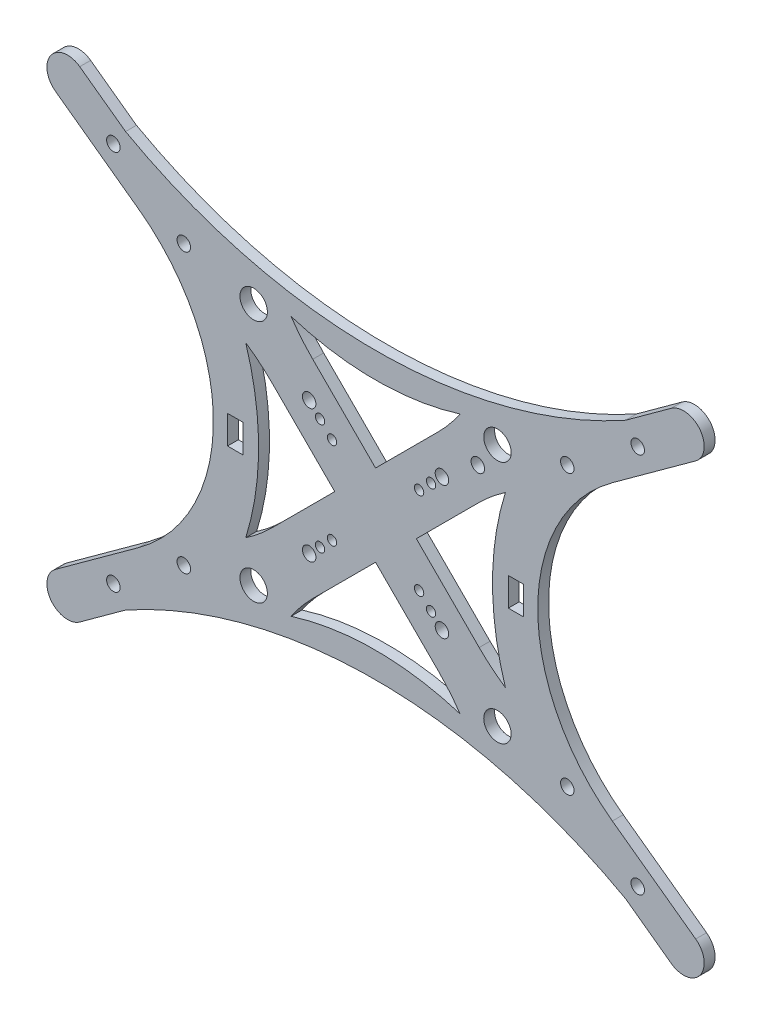
from build123d import *

# Parameters (mm, degrees)
SKETCH_7_R          = 1.075
SKETCH_7_R_2        = 1.55
SKETCH_7_R_3        = 3.15
SKETCH_7_R_4        = 3.150000003
EXTRUDE_2_5_DEPTH   = 2.5
CUT_EXTRUDE_2_DEPTH = 95.113928094
SKETCH_8_W          = 3.5
SKETCH_8_H          = 6.5
CUT_EXTRUDE_3_DEPTH = 95.113928094
PCB_2_R             = 1.55
PCB_DEPTH           = 95.113928094


with BuildPart() as part:
    # 草图7 → 主结构-厚度还是得2.5, 不然铝柱不好选 (new body)
    with BuildSketch(Plane.XY):
        with BuildLine():
            Line((-67.948496874, -55.238795586), (-57.42060576, -47.589834961))
            ThreePointArc((-57.42060576, -47.589834961), (0, -32.757979874), (57.42060576, -47.589834961))
            Line((57.42060576, -47.589834961), (67.948496874, -55.238795586))
            ThreePointArc((67.948496874, -55.238795586), (74.583307546, -54.187944811), (73.532456771, -47.55313414))
            Line((73.532456771, -47.55313414), (54.395000648, -33.648958388))
            ThreePointArc((54.395000648, -33.648958388), (37.25, 0), (54.395000648, 33.648958388))
            Line((54.395000648, 33.648958388), (73.532456771, 47.55313414))
            ThreePointArc((73.532456771, 47.55313414), (74.583307546, 54.187944811), (67.948496874, 55.238795586))
            Line((67.948496874, 55.238795586), (57.42060576, 47.589834961))
            ThreePointArc((57.42060576, 47.589834961), (0, 32.757979874), (-57.42060576, 47.589834961))
            Line((-57.42060576, 47.589834961), (-67.948496874, 55.238795586))
            ThreePointArc((-67.948496874, 55.238795586), (-74.583307546, 54.187944811), (-73.532456771, 47.55313414))
            Line((-73.532456771, 47.55313414), (-54.395000648, 33.648958388))
            ThreePointArc((-54.395000648, 33.648958388), (-37.25, 0), (-54.395000648, -33.648958388))
            Line((-54.395000648, -33.648958388), (-73.532456771, -47.55313414))
            ThreePointArc((-73.532456771, -47.55313414), (-74.583307546, -54.187944811), (-67.948496874, -55.238795586))
        make_face()
        with Locations((10, 10)):
            Circle(SKETCH_7_R, mode=Mode.SUBTRACT)
        with Locations((12.75, 12.75)):
            Circle(SKETCH_7_R, mode=Mode.SUBTRACT)
        with Locations((15.25, 15.25)):
            Circle(SKETCH_7_R_2, mode=Mode.SUBTRACT)
        with Locations((15.25, -15.25)):
            Circle(SKETCH_7_R_2, mode=Mode.SUBTRACT)
        with Locations((12.75, -12.75)):
            Circle(SKETCH_7_R, mode=Mode.SUBTRACT)
        with Locations((10, -10)):
            Circle(SKETCH_7_R, mode=Mode.SUBTRACT)
        with Locations((28, -28)):
            Circle(SKETCH_7_R_3, mode=Mode.SUBTRACT)
        with Locations((28, 28)):
            Circle(SKETCH_7_R_4, mode=Mode.SUBTRACT)
        with Locations((60.224561343, 43.755705046)):
            Circle(SKETCH_7_R_2, mode=Mode.SUBTRACT)
        with Locations((-60.224561343, 43.755705046)):
            Circle(SKETCH_7_R_2, mode=Mode.SUBTRACT)
        with Locations((-28, 28)):
            Circle(SKETCH_7_R_4, mode=Mode.SUBTRACT)
        with Locations((-28, -28)):
            Circle(SKETCH_7_R_3, mode=Mode.SUBTRACT)
        with Locations((-10, -10)):
            Circle(SKETCH_7_R, mode=Mode.SUBTRACT)
        with Locations((-12.75, -12.75)):
            Circle(SKETCH_7_R, mode=Mode.SUBTRACT)
        with Locations((-15.25, -15.25)):
            Circle(SKETCH_7_R_2, mode=Mode.SUBTRACT)
        with Locations((-15.25, 15.25)):
            Circle(SKETCH_7_R_2, mode=Mode.SUBTRACT)
        with Locations((-12.75, 12.75)):
            Circle(SKETCH_7_R, mode=Mode.SUBTRACT)
        with Locations((-10, 10)):
            Circle(SKETCH_7_R, mode=Mode.SUBTRACT)
        with Locations((60.224561343, -43.755705046)):
            Circle(SKETCH_7_R_2, mode=Mode.SUBTRACT)
        with Locations((44.044221455, -32)):
            Circle(SKETCH_7_R_2, mode=Mode.SUBTRACT)
        with Locations((44.044221455, 32)):
            Circle(SKETCH_7_R_2, mode=Mode.SUBTRACT)
        with Locations((-44.044221455, 32)):
            Circle(SKETCH_7_R_2, mode=Mode.SUBTRACT)
        with Locations((-60.224561343, -43.755705046)):
            Circle(SKETCH_7_R_2, mode=Mode.SUBTRACT)
        with Locations((-44.044221455, -32)):
            Circle(SKETCH_7_R_2, mode=Mode.SUBTRACT)
    extrude(amount=EXTRUDE_2_5_DEPTH)

    # 草图6 → 切除-拉伸2 (cut, through all)
    with BuildSketch(Plane.XY):
        with BuildLine():
            Line((-23.801448899, 14.429581723), (-9.371867176, 0))
            Line((-9.371867176, 0), (-23.801448899, -14.429581723))
            ThreePointArc((-23.801448899, -14.429581723), (-26.692624222, -17.058284994), (-29.820182402, -19.400795498))
            ThreePointArc((-29.820182402, -19.400795498), (-26.863678166, 0), (-29.820182402, 19.400795498))
            ThreePointArc((-29.820182402, 19.400795498), (-26.692624222, 17.058284994), (-23.801448899, 14.429581723))
        make_face()
        with BuildLine():
            Line((14.429581723, 23.801448899), (0, 9.371867176))
            Line((0, 9.371867176), (-14.429581723, 23.801448899))
            ThreePointArc((-14.429581723, 23.801448899), (-17.058284994, 26.692624222), (-19.400795498, 29.820182402))
            ThreePointArc((-19.400795498, 29.820182402), (0, 26.863678166), (19.400795498, 29.820182402))
            ThreePointArc((19.400795498, 29.820182402), (17.058284994, 26.692624222), (14.429581723, 23.801448899))
        make_face()
        with BuildLine():
            Line((23.801448899, -14.429581723), (9.371867176, 0))
            Line((9.371867176, 0), (23.801448899, 14.429581723))
            ThreePointArc((23.801448899, 14.429581723), (26.692624222, 17.058284994), (29.820182402, 19.400795498))
            ThreePointArc((29.820182402, 19.400795498), (26.863678166, 0), (29.820182402, -19.400795498))
            ThreePointArc((29.820182402, -19.400795498), (26.692624222, -17.058284994), (23.801448899, -14.429581723))
        make_face()
        with BuildLine():
            Line((-14.429581723, -23.801448899), (0, -9.371867176))
            Line((0, -9.371867176), (14.429581723, -23.801448899))
            ThreePointArc((14.429581723, -23.801448899), (17.058284994, -26.692624222), (19.400795498, -29.820182402))
            ThreePointArc((19.400795498, -29.820182402), (0, -26.863678166), (-19.400795498, -29.820182402))
            ThreePointArc((-19.400795498, -29.820182402), (-17.058284994, -26.692624222), (-14.429581723, -23.801448899))
        make_face()
    extrude(amount=CUT_EXTRUDE_2_DEPTH, mode=Mode.SUBTRACT)

    # 草图8 → 切除-拉伸3 (cut, through all)
    with BuildSketch(Plane.XY):
        with Locations((32.25, 0)):
            Rectangle(SKETCH_8_W, SKETCH_8_H)
        with Locations((-32.25, 0)):
            Rectangle(SKETCH_8_W, SKETCH_8_H)
    extrude(amount=CUT_EXTRUDE_3_DEPTH, mode=Mode.SUBTRACT)

    # PCB 2 → PCB (cut, through all)
    with BuildSketch(Plane.XY):
        with Locations((23.5, 21.71275604)):
            Circle(PCB_2_R)
        with Locations((-32, 42)):
            Circle(PCB_2_R)
        with Locations((32, 42)):
            Circle(PCB_2_R)
        with Locations((-36, -43)):
            Circle(PCB_2_R)
        with Locations((36, -43)):
            Circle(PCB_2_R)
        with Locations((-29.25, -40.5)):
            Circle(PCB_2_R)
        with Locations((29.25, -40.5)):
            Circle(PCB_2_R)
        with Locations((-17.5, 47.5)):
            Circle(PCB_2_R)
        with Locations((17.5, 47.5)):
            Circle(PCB_2_R)
    extrude(amount=PCB_DEPTH, mode=Mode.SUBTRACT)


solid = part.part
